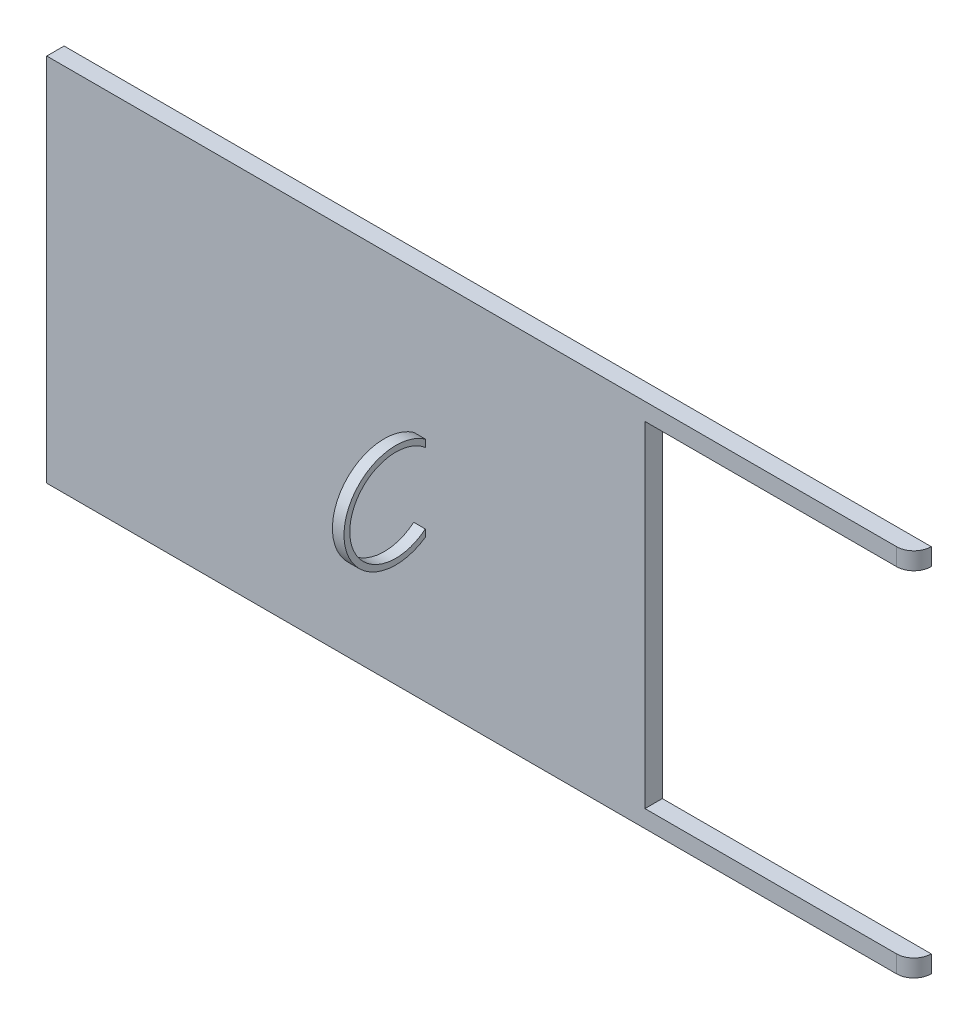
from build123d import *

# Parameters (mm, degrees)
SKETCH1_W           = 103.47926424
SKETCH1_H           = 64
BOSS_EXTRUDE1_DEPTH = 3
SKETCH2_W           = 46.52073576
SKETCH2_H           = 3
BOSS_EXTRUDE2_DEPTH = 3
FILLET1_R           = 3
SKETCH3_R           = 8.958865037
SKETCH3_R_2         = 7.958865037
EXTRUDE_THIN1_DEPTH = 2


with BuildPart() as part:
    # Sketch1 → Boss-Extrude1 (new body)
    with BuildSketch(Plane.XY):
        with Locations((11.73963212, 81.73418814)):
            Rectangle(SKETCH1_W, SKETCH1_H)
    extrude(amount=BOSS_EXTRUDE1_DEPTH)

    # Sketch2 → Boss-Extrude2 (add)
    with BuildSketch(Plane.XY.offset(3)):
        with Locations((86.73963212, 112.23418814)):
            Rectangle(SKETCH2_W, SKETCH2_H)
        with Locations((86.73963212, 51.23418814)):
            Rectangle(SKETCH2_W, SKETCH2_H)
    extrude(amount=-BOSS_EXTRUDE2_DEPTH)

    # Fillet1
    fillet1_edges = [part.edges().sort_by_distance(p)[0] for p in [
        (110, 51.23418814, 3),
        (110, 112.23418814, 3),
    ]]
    fillet(fillet1_edges, radius=FILLET1_R - 0.0001)  # a hair under: the kernel refuses the full size

    # Sketch3 → Extrude-Thin1 (add)
    with BuildSketch(Plane(origin=(23.47926424, 0, 0), x_dir=(0, 0, -1), z_dir=(1, 0, 0))):
        with Locations((-8.102432793, 81.734499249)):
            Circle(SKETCH3_R)
        with Locations((-8.102432793, 81.734499249)):
            Circle(SKETCH3_R_2, mode=Mode.SUBTRACT)
    extrude(amount=EXTRUDE_THIN1_DEPTH)


solid = part.part
